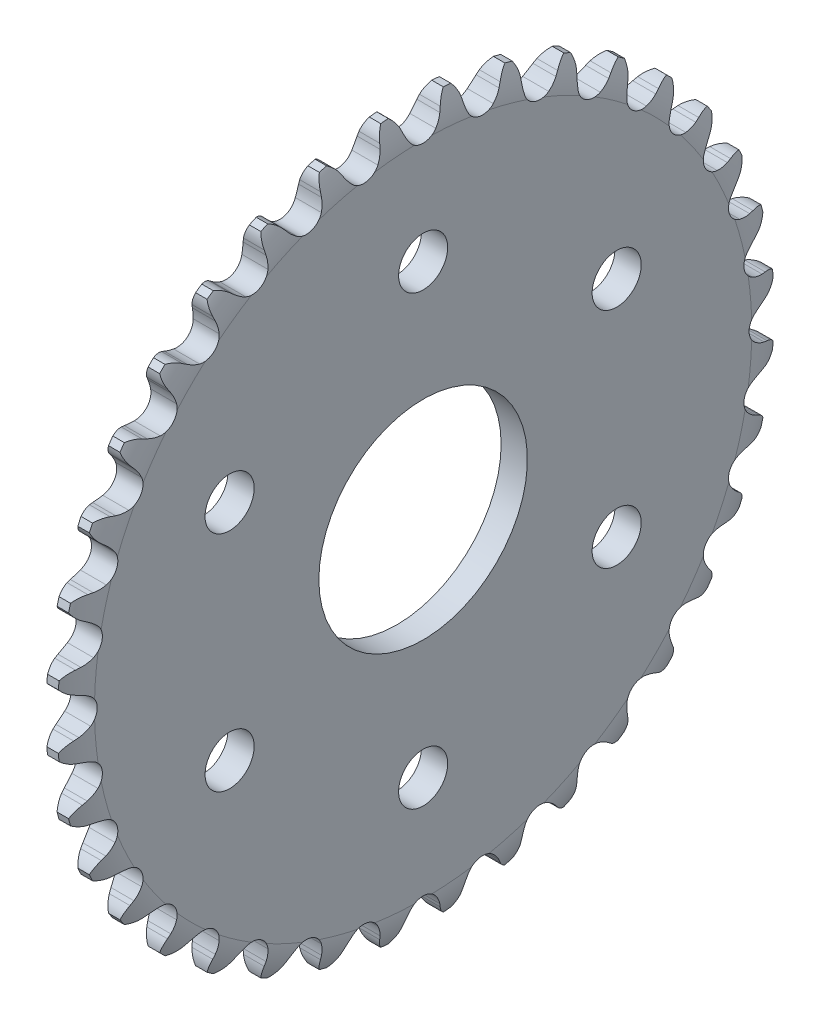
from build123d import *

# Parameters (mm, degrees)
TOOTHCUT_DEPTH    = 55.089015361
TEETHCUTS_COUNT   = 36
TEETHCUTS_ANGLE   = 350
BORSKE_R          = 11.1125
BORE_DEPTH        = 50.8000508
EXTRUDE1_DEPTH    = 54.930466244
CIRPATTERN1_COUNT = 6


with BuildPart() as part:
    # BasProSke → Base-Revolve (revolve)
    with BuildSketch(Plane(origin=(0, 0, 0), x_dir=(1, 0, 0), z_dir=(0, 1, 0))):
        with BuildLine():
            Line((0, 0), (0, 35.020416103))
            ThreePointArc((0, 35.020416103), (0.199787117, 36.656006498), (0.7874, 38.195416103))
            Line((0.7874, 38.195416103), (2.01295, 38.195416103))
            ThreePointArc((2.01295, 38.195416103), (2.600562883, 36.656006498), (2.80035, 35.020416103))
            Line((2.80035, 35.020416103), (2.80035, 0))
            Line((2.80035, 0), (0, 0))
        make_face()
    revolve(axis=Axis((-10, 0, 0), (1, 0, 0)))

    # TooCutSke → ToothCut (cut, through all)
    with BuildSketch(Plane(origin=(0, 0, 0), x_dir=(0, 0, -1), z_dir=(1, 0, 0))):
        with BuildLine():
            Line((1.95260897, 36.506681138), (2.113680484, 36.943937289))
            ThreePointArc((2.113680484, 36.943937289), (3.086471, 38.204095647), (4.60520885, 38.681333339))
            ThreePointArc((4.60520885, 38.681333339), (0, 38.954505483), (-4.60520885, 38.681333339))
            ThreePointArc((-4.60520885, 38.681333339), (-3.086471, 38.204095647), (-2.113680484, 36.943937289))
            Line((-2.113680484, 36.943937289), (-1.95260897, 36.506681138))
            ThreePointArc((-1.95260897, 36.506681138), (-1.696264974, 35.939821649), (-1.361487812, 35.415449475))
            ThreePointArc((-1.361487812, 35.415449475), (0, 34.731684597), (1.361487812, 35.415449475))
            ThreePointArc((1.361487812, 35.415449475), (1.696264974, 35.939821649), (1.95260897, 36.506681138))
        make_face()
    toothcut = extrude(amount=TOOTHCUT_DEPTH, mode=Mode.SUBTRACT)

    # TeethCuts: ToothCut ×36 about axis
    teethcuts_axis = Axis((-10, 0, 0), (1, 0, 0))
    for i in range(1, TEETHCUTS_COUNT):
        add(toothcut.rotate(teethcuts_axis, i * TEETHCUTS_ANGLE / (TEETHCUTS_COUNT - 1)), mode=Mode.SUBTRACT)

    # BorSke → Bore (cut, symmetric)
    with BuildSketch(Plane(origin=(0, 0, 0), x_dir=(0, 0, -1), z_dir=(1, 0, 0))):
        Circle(BORSKE_R)
    extrude(amount=BORE_DEPTH, both=True, mode=Mode.SUBTRACT)

    # Sketch1 → Extrude1 (cut, through all)
    with BuildSketch(Plane(origin=(2.80035, 0, 0), x_dir=(0, 0, -1), z_dir=(1, 0, 0))):
        with BuildLine():
            ThreePointArc((2.6162, 23.8125), (-0.071885435, 26.427712214), (-2.612249602, 23.668783413))
            ThreePointArc((-2.612249602, 23.668783413), (0, 21.1963), (2.612249602, 23.668783413))
            ThreePointArc((2.612249602, 23.668783413), (2.615212214, 23.740614565), (2.6162, 23.8125))
        make_face()
    extrude1 = extrude(amount=-EXTRUDE1_DEPTH, mode=Mode.SUBTRACT)

    # CirPattern1: Extrude1 ×6 about axis
    cirpattern1_axis = Axis((2.80035, 0, 0), (1, 0, 0))
    for i in range(1, CIRPATTERN1_COUNT):
        add(extrude1.rotate(cirpattern1_axis, i * 360 / CIRPATTERN1_COUNT), mode=Mode.SUBTRACT)


solid = part.part
